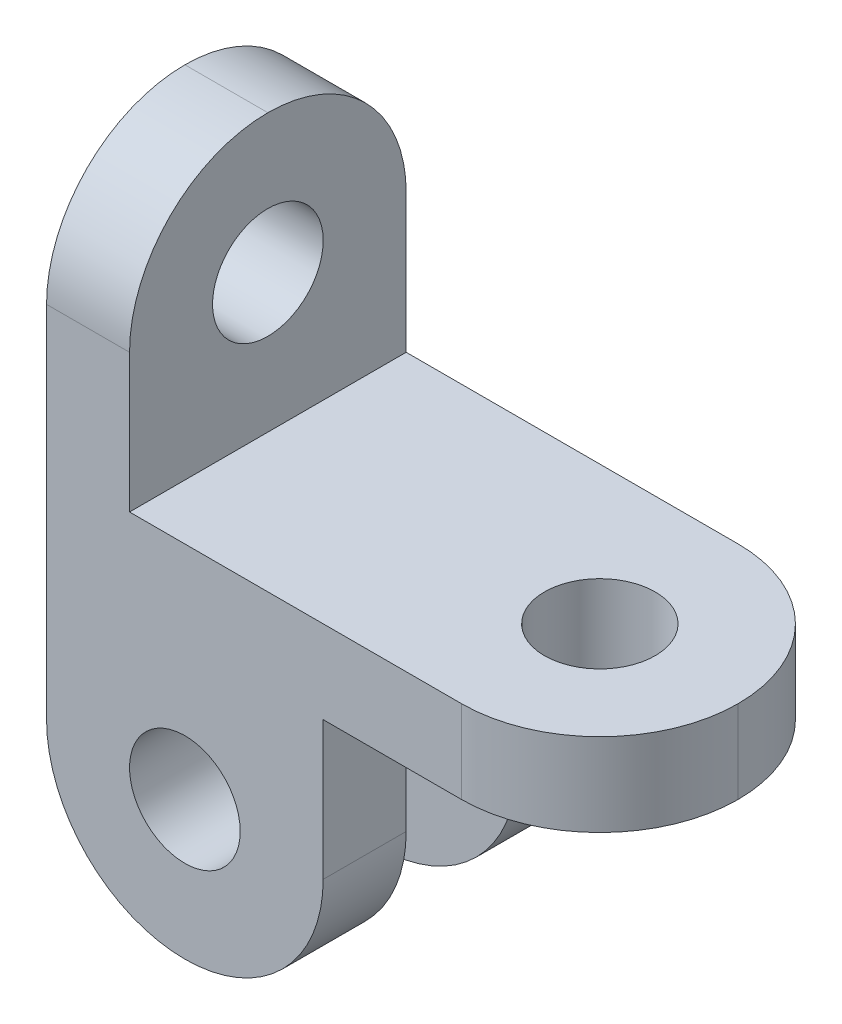
from build123d import *

# Parameters (mm, degrees)
SKETCH1_W           = 80
SKETCH1_H           = 40
BOSS_EXTRUDE1_DEPTH = 12
SKETCH2_W           = 12
SKETCH2_H           = 40
BOSS_EXTRUDE2_DEPTH = 40
SKETCH3_W           = 40
SKETCH3_H           = 12
BOSS_EXTRUDE3_DEPTH = 40
FILLET1_R           = 20
SKETCH4_R           = 8
CUT_EXTRUDE1_DEPTH  = 12
SKETCH5_R           = 8
CUT_EXTRUDE2_DEPTH  = 12
SKETCH6_R           = 8
CUT_EXTRUDE3_DEPTH  = 80.961215088


with BuildPart() as part:
    # Sketch1 → Boss-Extrude1 (new body)
    with BuildSketch(Plane(origin=(0, 0, 0), x_dir=(1, 0, 0), z_dir=(0, 1, 0))):
        with Locations((5.714285714, -3.314285714)):
            Rectangle(SKETCH1_W, SKETCH1_H)
    extrude(amount=BOSS_EXTRUDE1_DEPTH)

    # Sketch2 → Boss-Extrude2 (add)
    with BuildSketch(Plane(origin=(0, 12, 0), x_dir=(1, 0, 0), z_dir=(0, 1, 0))):
        with Locations((-28.285714286, -3.314285714)):
            Rectangle(SKETCH2_W, SKETCH2_H)
    extrude(amount=BOSS_EXTRUDE2_DEPTH)

    # Sketch3 → Boss-Extrude3 (add)
    with BuildSketch(Plane.XZ):
        with Locations((-14.285714286, 17.314285714)):
            Rectangle(SKETCH3_W, SKETCH3_H)
        with Locations((-14.285714286, -10.685714286)):
            Rectangle(SKETCH3_W, SKETCH3_H)
    extrude(amount=BOSS_EXTRUDE3_DEPTH)

    # Fillet1
    fillet1_edges = [part.edges().sort_by_distance(p)[0] for p in [
        (-34.285714286, -40, -10.685714286),
        (-34.285714286, -40, 17.314285714),
        (5.714285714, -40, -10.685714286),
        (5.714285714, -40, 17.314285714),
        (45.714285714, 6, -16.685714286),
        (45.714285714, 6, 23.314285714),
        (-28.285714286, 52, -16.685714286),
        (-28.285714286, 52, 23.314285714),
    ]]
    fillet(fillet1_edges, radius=FILLET1_R - 0.0001)  # a hair under: the kernel refuses the full size

    # Sketch4 → Cut-Extrude1 (cut)
    with BuildSketch(Plane(origin=(-22.285714286, 0, 0), x_dir=(0, 0, -1), z_dir=(1, 0, 0))):
        with Locations((-3.314285714, 32)):
            Circle(SKETCH4_R)
    extrude(amount=-CUT_EXTRUDE1_DEPTH, mode=Mode.SUBTRACT)

    # Sketch5 → Cut-Extrude2 (cut)
    with BuildSketch(Plane(origin=(0, 12, 0), x_dir=(1, 0, 0), z_dir=(0, 1, 0))):
        with Locations(Location((25.714285714, -3.314285714, 0), (0, 0, 270))):
            Circle(SKETCH5_R)
    extrude(amount=-CUT_EXTRUDE2_DEPTH, mode=Mode.SUBTRACT)

    # Sketch6 → Cut-Extrude3 (cut, through all)
    with BuildSketch(Plane.XY.offset(23.314285714)):
        with Locations((-14.285714286, -20)):
            Circle(SKETCH6_R)
    extrude(amount=-CUT_EXTRUDE3_DEPTH, mode=Mode.SUBTRACT)


solid = part.part
